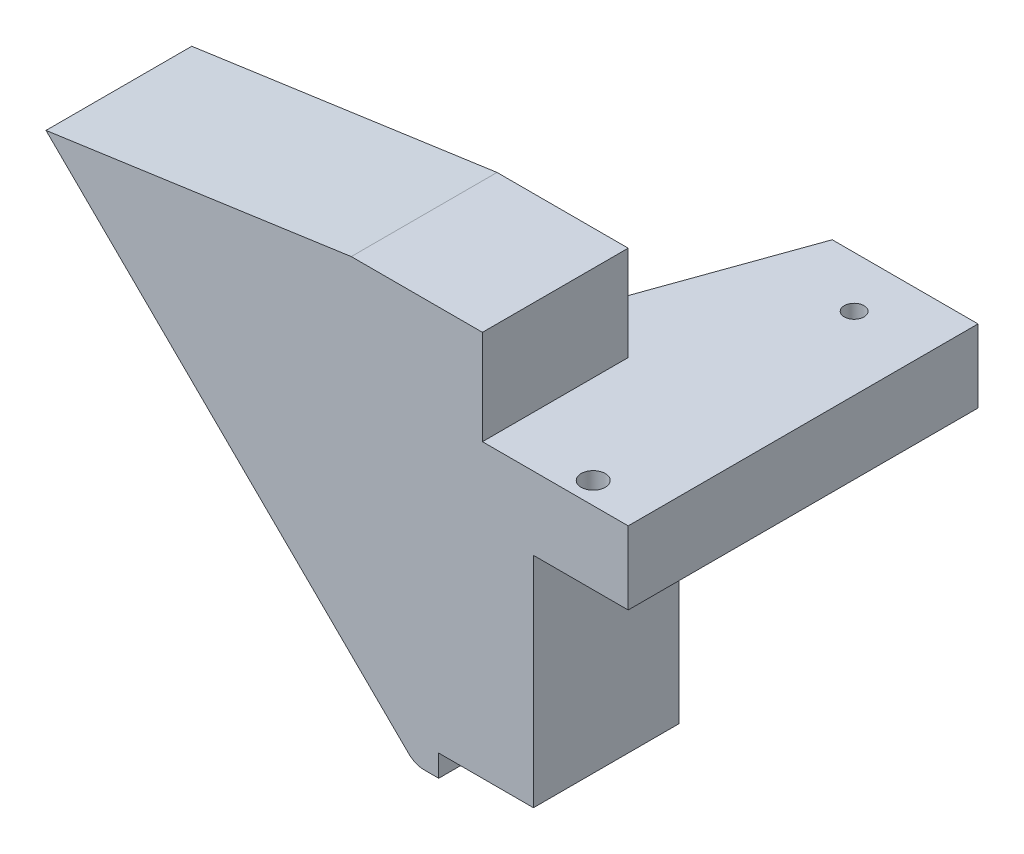
from build123d import *

# Parameters (mm, degrees)
EXTRUDE_1_DEPTH       = 172
SHELL_START           = 6
SHELL_1_DEPTH         = 160
SKETCH_2_W            = 36
SKETCH_2_H            = 16
CUT_EXTRUDE_1_DEPTH   = 74
EXTRUDE_2_DEPTH       = 2
SKETCH_4_R            = 10
CUT_EXTRUDE_2_DEPTH   = 186
SKETCH_5_R            = 1.5
CUT_EXTRUDE_3_DEPTH   = 10
EXTRUDE_3_DEPTH       = 172
SKETCH_7_W            = 36
SKETCH_7_H            = 16
CUT_EXTRUDE_4_DEPTH   = 172
SKETCH_8_W            = 6
SKETCH_8_H            = 172
CUT_EXTRUDE_5_DEPTH   = 3
EXTRUDE_4_DEPTH       = 15
CHAMFER_1_SIZE        = 15
CHAMFER_2_SIZE        = 15
CHAMFER_3_SIZE        = 8
SKETCH_10_R           = 1.35
CUT_EXTRUDE_6_DEPTH   = 15
SKETCH_12_R           = 1.35
CUT_EXTRUDE_7_DEPTH   = 15
SKETCH_14_OUTSIDE_W   = 213.548
SKETCH_14_OUTSIDE_H   = 97.548
SKETCH_14_OUTSIDE_W_2 = 15
SKETCH_14_OUTSIDE_H_2 = 56
CUT_EXTRUDE_8_DEPTH   = 82.5
EXTRUDE_5_DEPTH       = 15
CUT_EXTRUDE_9_DEPTH   = 15
SKETCH_17_W           = 13
SKETCH_17_H           = 5
EXTRUDE_6_DEPTH       = 15
EXTRUDE_7_DEPTH       = 20
SHELL_START_2         = 78.159554327
SHELL_2_DEPTH         = 10
EXTRUDE_8_DEPTH       = 28
CUT_EXTRUDE_10_DEPTH  = 20
CUT_EXTRUDE_11_DEPTH  = 20
SKETCH_23_R           = 1.65
SKETCH_23_R_2         = 1.35
CUT_EXTRUDE_12_DEPTH  = 22
SKETCH_26_R           = 1.35
CUT_EXTRUDE_14_DEPTH  = 10
CUT_EXTRUDE_15_DEPTH  = 82.5


# Read off the part's stored shape, not the designer's step: 抽壳1, 抽壳2
with BuildPart() as part:
    # 草图1 → 凸台-拉伸1 (new body)
    with BuildSketch(Plane.XY):
        with BuildLine():
            Line((0, 0), (0, 40))
            Line((0, 40), (-5, 40))
            Line((-5, 40), (-5, 53))
            Line((-5, 53), (-23, 53))
            Line((-23, 53), (-64.888578151, 47.050698608))
            Line((-64.888578151, 47.050698608), (-15.121320344, -2.121320344))
            ThreePointArc((-15.121320344, -2.121320344), (-14.148050297, -2.771638598), (-13, -3))
            Line((-13, -3), (-5, -3))
            Line((-5, -3), (-5, 0))
            Line((-5, 0), (0, 0))
        make_face()
    extrude(amount=EXTRUDE_1_DEPTH)

    # 抽壳1 outline → 抽壳1 (cut)
    with BuildSketch(Plane.XY.offset(SHELL_START)):
        Polygon((-11, 6), (-6, 6), (-6, 34), (-11, 34), (-11, 47), (-22.576046832, 47), (-52.061983815, 42.812206246), (-11.767841448, 3), (-11, 3), align=None)
    extrude(amount=SHELL_1_DEPTH, mode=Mode.SUBTRACT)

    # 草图2 → 切除-拉伸1 (cut)
    with BuildSketch(Plane(origin=(0, 0, 0), x_dir=(0, 0, -1), z_dir=(1, 0, 0))):
        with Locations((-136, 10)):
            Rectangle(SKETCH_2_W, SKETCH_2_H)
        with Locations((-36, 10)):
            Rectangle(SKETCH_2_W, SKETCH_2_H)
    extrude(amount=-CUT_EXTRUDE_1_DEPTH, mode=Mode.SUBTRACT)

    # 草图3 → 凸台-拉伸2 (add, symmetric)
    with BuildSketch(Plane(origin=(0, 0, 86), x_dir=(-1, 0, 0), z_dir=(0, 0, -1))):
        Polygon((5, 53), (5, 40), (0, 40), (0, 0), (5, 0), (5, -3), (13, -3), (16.579355858, -0.680723591), (64.888578151, 47.050698608), (23, 53), align=None)
    extrude(amount=EXTRUDE_2_DEPTH, both=True)

    # 草图4 → 切除-拉伸2 (cut)
    with BuildSketch(Plane.XY.offset(172)):
        with Locations((-15, 21.071297481)):
            Circle(SKETCH_4_R)
    extrude(amount=-CUT_EXTRUDE_2_DEPTH, mode=Mode.SUBTRACT)

    # 草图5 → 切除-拉伸3 (cut)
    with BuildSketch(Plane(origin=(0, 53, 0), x_dir=(1, 0, 0), z_dir=(0, 1, 0))):
        with Locations(Location((-13.338195438, -63.5, 0), (0, 0, 270))):
            Circle(SKETCH_5_R)
        with Locations(Location((-13.338195438, -108.5, 0), (0, 0, 270))):
            Circle(SKETCH_5_R)
    extrude(amount=-CUT_EXTRUDE_3_DEPTH, mode=Mode.SUBTRACT)

    # 草图6 → 凸台-拉伸3 (add)
    with BuildSketch(Plane.XY.offset(172)):
        Polygon((-11, 6), (-14.804157153, 6), (-11.767841448, 3), (-11, 3), align=None)
    extrude(amount=-EXTRUDE_3_DEPTH)

    # 草图7 → 切除-拉伸4 (cut)
    with BuildSketch(Plane(origin=(0, 0, 0), x_dir=(0, 0, -1), z_dir=(1, 0, 0))):
        with Locations((-136, 10)):
            Rectangle(SKETCH_7_W, SKETCH_7_H)
        with Locations((-36, 10)):
            Rectangle(SKETCH_7_W, SKETCH_7_H)
    extrude(amount=-CUT_EXTRUDE_4_DEPTH, mode=Mode.SUBTRACT)

    # 草图8 → 切除-拉伸5 (cut)
    with BuildSketch(Plane.XZ.offset(3)):
        with Locations((-8, 86)):
            Rectangle(SKETCH_8_W, SKETCH_8_H)
    extrude(amount=-CUT_EXTRUDE_5_DEPTH, mode=Mode.SUBTRACT)

    # 草图9 → 凸台-拉伸4 (add)
    with BuildSketch(Plane(origin=(0, 0, 0), x_dir=(0, 0, -1), z_dir=(1, 0, 0))):
        Polygon((-86, 40), (-151, 40), (-151, 35), (-86, 35), (-21, 35), (-21, 40), align=None)
    extrude(amount=EXTRUDE_4_DEPTH)

    # 倒角1
    chamfer_1_edges = [part.edges().sort_by_distance(p)[0] for p in [
        (15, 37.5, 151),
    ]]
    chamfer(chamfer_1_edges, length=CHAMFER_1_SIZE - 0.0001)  # a hair under: the kernel refuses the full size

    # 倒角2
    chamfer_2_edges = [part.edges().sort_by_distance(p)[0] for p in [
        (15, 37.5, 21),
    ]]
    chamfer(chamfer_2_edges, length=CHAMFER_2_SIZE - 0.0001)  # a hair under: the kernel refuses the full size

    # 倒角3
    chamfer_3_edges = [part.edges().sort_by_distance(p)[0] for p in [
        (0, 35, 86),
    ]]
    chamfer(chamfer_3_edges, length=CHAMFER_3_SIZE)

    # 草图10 → 切除-拉伸6 (cut)
    with BuildSketch(Plane.XZ):
        with Locations((-5, 158)):
            Circle(SKETCH_10_R)
        with Locations((-5, 111)):
            Circle(SKETCH_10_R)
        with Locations((-5, 61)):
            Circle(SKETCH_10_R)
        with Locations((-5, 14.01360213)):
            Circle(SKETCH_10_R)
    extrude(amount=-CUT_EXTRUDE_6_DEPTH, mode=Mode.SUBTRACT)

    # 草图12 → 切除-拉伸7 (cut)
    with BuildSketch(Plane(origin=(0, 40, 0), x_dir=(1, 0, 0), z_dir=(0, 1, 0))):
        with Locations(Location((5, -41, 0), (0, 0, 270))):
            Circle(SKETCH_12_R)
        with Locations(Location((5, -86, 0), (0, 0, 270))):
            Circle(SKETCH_12_R)
        with Locations(Location((5, -131, 0), (0, 0, 270))):
            Circle(SKETCH_12_R)
    extrude(amount=-CUT_EXTRUDE_7_DEPTH, mode=Mode.SUBTRACT)

    # 草图14 outside → 切除-拉伸8 (cut, symmetric)
    with BuildSketch(Plane(origin=(0, 0, 0), x_dir=(0, 0, -1), z_dir=(1, 0, 0))):
        with Locations((-86, 25)):
            Rectangle(SKETCH_14_OUTSIDE_W, SKETCH_14_OUTSIDE_H)
        with Locations((-75.659554327, 25)):
            Rectangle(SKETCH_14_OUTSIDE_W_2, SKETCH_14_OUTSIDE_H_2, mode=Mode.SUBTRACT)
    extrude(amount=CUT_EXTRUDE_8_DEPTH, both=True, mode=Mode.SUBTRACT)

    # 草图15 → 凸台-拉伸5 (add)
    with BuildSketch(Plane(origin=(0, 0, 68.159554327), x_dir=(-1, 0, 0), z_dir=(0, 0, -1))):
        Polygon((0, 0), (-2, 0), (-2, 29), (0, 27), align=None)
    extrude(amount=-EXTRUDE_5_DEPTH)

    # 草图16 → 切除-拉伸9 (cut)
    with BuildSketch(Plane(origin=(0, 0, 68.159554327), x_dir=(-1, 0, 0), z_dir=(0, 0, -1))):
        Polygon((-2, 29), (-2, 35), (-8, 35), align=None)
    extrude(amount=-CUT_EXTRUDE_9_DEPTH, mode=Mode.SUBTRACT)

    # 草图17 → 凸台-拉伸6 (add)
    with BuildSketch(Plane(origin=(0, 0, 68.159554327), x_dir=(-1, 0, 0), z_dir=(0, 0, -1))):
        with Locations((-8.5, 32.5)):
            Rectangle(SKETCH_17_W, SKETCH_17_H)
    extrude(amount=-EXTRUDE_6_DEPTH)

    # 草图18 → 凸台-拉伸7 (add)
    with BuildSketch(Plane(origin=(0, 0, 68.159554327), x_dir=(-1, 0, 0), z_dir=(0, 0, -1))):
        with BuildLine():
            Line((-15, 40), (-15, 30))
            Line((-15, 30), (-2, 30))
            Line((-2, 30), (-2, 0))
            Line((-2, 0), (11, 0))
            Line((11, 0), (11, -3))
            Line((11, -3), (13, -3))
            ThreePointArc((13, -3), (14.148050297, -2.771638598), (15.121320344, -2.121320344))
            Line((15.121320344, -2.121320344), (64.888578151, 47.050698608))
            Line((64.888578151, 47.050698608), (23, 53))
            Line((23, 53), (5, 53))
            Line((5, 53), (5, 40))
            Line((5, 40), (-15, 40))
        make_face()
    extrude(amount=-EXTRUDE_7_DEPTH)

    # 抽壳2 outline → 抽壳2 (cut)
    with BuildSketch(Plane.XY.offset(SHELL_START_2)):
        Polygon((-8, 30), (-15, 30), (-15, 43), (-22.293411387, 43), (-43.510920925, 39.986544671), (-13.161382076, 10), (-8, 10), align=None)
    extrude(amount=SHELL_2_DEPTH, mode=Mode.SUBTRACT)

    # 草图20 → 凸台-拉伸8 (add)
    with BuildSketch(Plane.XY.offset(88.159554327)):
        Polygon((15, 40), (-15, 40), (-15, 30), (-8, 30), (-8, 22), (2, 22), (2, 30), (15, 30), align=None)
    extrude(amount=EXTRUDE_8_DEPTH)

    # 草图21 → 切除-拉伸10 (cut)
    with BuildSketch(Plane(origin=(2, 0, 0), x_dir=(0, 0, -1), z_dir=(1, 0, 0))):
        Polygon((-116.159554327, 30), (-88.159554327, 22), (-116.159554327, 22), align=None)
    extrude(amount=-CUT_EXTRUDE_10_DEPTH, mode=Mode.SUBTRACT)

    # 草图22 → 切除-拉伸11 (cut)
    with BuildSketch(Plane(origin=(0, 40, 0), x_dir=(1, 0, 0), z_dir=(0, 1, 0))):
        Polygon((-8, -116.159554327), (-15, -116.159554327), (-15, -88.159554327), (-5, -116.159554327), align=None)
    extrude(amount=-CUT_EXTRUDE_11_DEPTH, mode=Mode.SUBTRACT)

    # 草图23 → 切除-拉伸12 (cut)
    with BuildSketch(Plane(origin=(0, 40, 0), x_dir=(1, 0, 0), z_dir=(0, 1, 0))):
        with Locations(Location((7.2, -71.159554327, 0), (0, 0, 270))):
            Circle(SKETCH_23_R)
        with Locations(Location((5, -109.159554327, 0), (0, 0, 270))):
            Circle(SKETCH_23_R_2)
    extrude(amount=-CUT_EXTRUDE_12_DEPTH, mode=Mode.SUBTRACT)

    # 草图26 → 切除-拉伸14 (cut)
    with BuildSketch(Plane.XZ):
        with Locations((-5, 78.159554327)):
            Circle(SKETCH_26_R)
    extrude(amount=-CUT_EXTRUDE_14_DEPTH, mode=Mode.SUBTRACT)


with BuildPart() as body_2:
    # 镜向2: mirrored copy
    add(part.part.mirror(Plane.XY.offset(126.159554327)))


with BuildPart() as part_1:
    add(part.part)

    # 草图27 → 切除-拉伸15 (cut, symmetric)
    with BuildSketch(Plane(origin=(0, 40, 0), x_dir=(1, 0, 0), z_dir=(0, 1, 0))):
        Polygon((-70.30444709, -126.427743847), (59.164340296, -124.069061785), (93.545633321, -94.969295867), (93.545633321, -36.488882893), (-105.077867855, -19.264077709), (-117.933649563, -88.897060516), align=None)
    extrude(amount=CUT_EXTRUDE_15_DEPTH, both=True, mode=Mode.SUBTRACT)


solid = body_2.part
